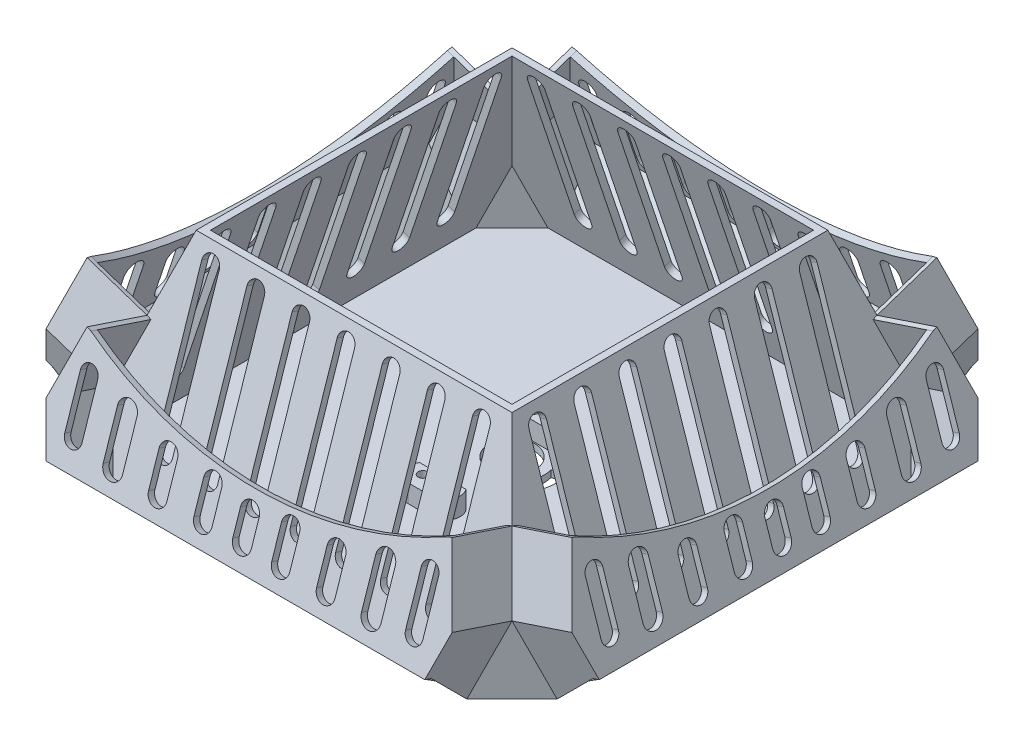
from build123d import *

# Parameters (mm, degrees)
CUT_EXTRUDE_1_DEPTH         = 128
SHELL_2_T                   = -3
EXTRUDE_1_DEPTH             = 25
EXTRUDE_2_DEPTH             = 25
EXTRUDE_3_DEPTH             = 25
EXTRUDE_4_DEPTH             = 25
CUT_EXTRUDE_2_DEPTH         = 130
CUT_EXTRUDE_3_DEPTH         = 130
CUT_EXTRUDE_4_DEPTH         = 130
SKETCH_14_R                 = 3.5
CUT_EXTRUDE_5_DEPTH         = 130
EXTRUDE_8_REACH             = 193.799
EXTRUDE_8_DIRECTION_2_REACH = 193.799
EXTRUDE_9_REACH             = 193.799
EXTRUDE_9_DIRECTION_2_REACH = 193.799
SKETCH_20_R                 = 10.1
CUT_EXTRUDE_6_DEPTH         = 26
CUT_EXTRUDE_7_DEPTH         = 10
PATTERN_CIRCULAR_2_COUNT    = 4
SKETCH_26_R                 = 2.1
CUT_EXTRUDE_10_DEPTH        = 10
SKETCH_37_R                 = 45
SKETCH_37_R_2               = 32.5
CUT_EXTRUDE_13_DEPTH        = 1
CUT_EXTRUDE_14_DEPTH        = 10
EXTRUDE_17_DEPTH            = 8
CUT_EXTRUDE_START           = -160
SKETCH_54_R                 = 2.1
SKETCH_54_R_2               = 10.1
CUT_EXTRUDE_15_DEPTH        = 160
CUT_EXTRUDE_16_DEPTH        = 160
PATTERN_CIRCULAR_3_COUNT    = 4
EXTRUDE_22_DEPTH            = 25
PATTERN_CIRCULAR_4_COUNT    = 4
EXTRUDE_24_DEPTH            = 3
PATTERN_CIRCULAR_5_COUNT    = 4
EXTRUDE_25_DEPTH            = 83.5
PATTERN_CIRCULAR_6_COUNT    = 4


with BuildPart() as part:
    # 草图2 → 放样1 section 0
    with BuildSketch(Plane(origin=(0, -90, 0), x_dir=(1, 0, 0), z_dir=(0, 1, 0))):
        with BuildLine():
            Line((-100, -100), (100, -100))
            Line((100, -100), (100, 100))
            Line((100, 100), (-100, 100))
            Line((-100, 100), (-100, -100))
        make_face()
    # 草图1 → 放样1 section 1
    with BuildSketch(Plane(origin=(0, 0, 0), x_dir=(1, 0, 0), z_dir=(0, 1, 0))):
        with BuildLine():
            Line((-70, 70), (70, 70))
            Line((70, 70), (70, -70))
            Line((70, -70), (-70, -70))
            Line((-70, -70), (-70, 70))
        make_face()
    loft()

    # 草图4 → 切除-拉伸1 (cut)
    with BuildSketch(Plane(origin=(0, 0, 0), x_dir=(1, 0, 0), z_dir=(0, 1, 0))):
        Polygon((-80, 100), (-100, 80), (-100, 100), align=None)
        Polygon((100, 80), (80, 100), (100, 100), align=None)
        Polygon((80, -100), (100, -80), (100, -100), align=None)
        Polygon((-100, -80), (-80, -100), (-100, -100), align=None)
    extrude(amount=-CUT_EXTRUDE_1_DEPTH, mode=Mode.SUBTRACT)

    # 抽壳2
    shell_2_openings = [part.faces().sort_by_distance(p)[0] for p in [
        (0, 0, 0),
    ]]
    offset(amount=SHELL_2_T, openings=shell_2_openings, kind=Kind.INTERSECTION)

    # 草图6 → 凸台-拉伸1 (add)
    with BuildSketch(Plane(origin=(0, 21, -63), x_dir=(-1, 0, 0), z_dir=(0, 0.3162277660168379, -0.9486832980505139))):
        Polygon((-90, -85.381496825), (-80, -117.004273426), (-76.853573455, -117.004273426), (-88.426786728, -80.406559639), align=None)
        Polygon((90, -85.381496825), (80, -117.004273426), (76.853573455, -117.004273426), (88.426786728, -80.406559639), align=None)
    extrude(amount=EXTRUDE_1_DEPTH)

    # 草图7 → 凸台-拉伸2 (add)
    with BuildSketch(Plane(origin=(-63, 21, 0), x_dir=(0, 0, 1), z_dir=(-0.9486832980505135, 0.31622776601683855, 0))):
        Polygon((-80, -117.004273426), (-90, -85.381496825), (-88.426786728, -80.406559639), (-76.853573455, -117.004273426), align=None)
        Polygon((80, -117.004273426), (90, -85.381496825), (88.426786728, -80.406559639), (76.853573455, -117.004273426), align=None)
    extrude(amount=EXTRUDE_2_DEPTH)

    # 草图8 → 凸台-拉伸3 (add)
    with BuildSketch(Plane(origin=(0, 21, 63), x_dir=(1, 0, 0), z_dir=(0, 0.3162277660168379, 0.9486832980505139))):
        Polygon((-90, -85.381496825), (-80, -117.004273426), (-76.853573455, -117.004273426), (-88.426786728, -80.406559639), align=None)
        Polygon((90, -85.381496825), (80, -117.004273426), (76.853573455, -117.004273426), (88.426786728, -80.406559639), align=None)
    extrude(amount=EXTRUDE_3_DEPTH)

    # 草图9 → 凸台-拉伸4 (add)
    with BuildSketch(Plane(origin=(63, 21, 0), x_dir=(0, 0, -1), z_dir=(0.9486832980505138, 0.316227766016838, 0))):
        Polygon((-90, -85.381496825), (-80, -117.004273426), (-76.853573455, -117.004273426), (-88.426786728, -80.406559639), align=None)
        Polygon((80, -117.004273426), (90, -85.381496825), (88.426786728, -80.406559639), (76.853573455, -117.004273426), align=None)
    extrude(amount=EXTRUDE_4_DEPTH)

    # 草图11 → 切除-拉伸2 (cut, symmetric)
    with BuildSketch(Plane.XY):
        Polygon((-100, -90), (-128.566874954, -61.433125046), (-128.566874954, -90), align=None)
    extrude(amount=CUT_EXTRUDE_2_DEPTH, both=True, mode=Mode.SUBTRACT)

    # 草图12 → 切除-拉伸3 (cut, symmetric)
    with BuildSketch(Plane(origin=(0, 0, 0), x_dir=(0, 0, -1), z_dir=(1, 0, 0))):
        Polygon((-100, -90), (-128.76067301, -61.23932699), (-128.76067301, -90), align=None)
        Polygon((128.76067301, -90), (100, -90), (128.76067301, -61.23932699), align=None)
    extrude(amount=CUT_EXTRUDE_3_DEPTH, both=True, mode=Mode.SUBTRACT)

    # 草图13 → 切除-拉伸4 (cut, symmetric)
    with BuildSketch(Plane.XY):
        Polygon((100, -90), (131.317962746, -58.682037254), (131.317962746, -90), align=None)
    extrude(amount=CUT_EXTRUDE_4_DEPTH, both=True, mode=Mode.SUBTRACT)

    # 草图14 → 切除-拉伸5 (cut, symmetric)
    with BuildSketch(Plane(origin=(0, -87, 0), x_dir=(1, 0, 0), z_dir=(0, 1, 0))):
        Circle(SKETCH_14_R)
    extrude(amount=CUT_EXTRUDE_5_DEPTH, both=True, mode=Mode.SUBTRACT)

    # 草图17 → 凸台-拉伸8 (add, up to next)
    with BuildSketch(Plane(origin=(0, 0, 0), x_dir=(0, 0, -1), z_dir=(1, 0, 0)), mode=Mode.PRIVATE) as extrude_8_sk1:
        Polygon((-119.764235376, -70.235764624), (-100, -90), (-98.939339828, -86.818019485), (-118.703575204, -67.053784109), align=None)
    extrude_8_tool1 = extrude(extrude_8_sk1.sketch, amount=EXTRUDE_8_REACH, mode=Mode.PRIVATE) - part.part
    # 草图17 → 凸台-拉伸8 (add, up to next)
    with BuildSketch(Plane(origin=(0, 0, 0), x_dir=(0, 0, -1), z_dir=(1, 0, 0)), mode=Mode.PRIVATE) as extrude_8_sk2:
        Polygon((118.703575204, -67.053784109), (119.764235376, -70.235764624), (100, -90), (98.939339828, -86.818019485), align=None)
    extrude_8_tool2 = extrude(extrude_8_sk2.sketch, amount=EXTRUDE_8_REACH, mode=Mode.PRIVATE) - part.part
    extrude_8_1 = extrude_8_tool1.solids().sort_by_distance((0, -78.526892, 109.351788))[0]
    add(extrude_8_1)
    extrude_8_2 = extrude_8_tool2.solids().sort_by_distance((0, -78.526892, -109.351788))[0]
    add(extrude_8_2)
    extrude_8 = extrude_8_1 + extrude_8_2  # 凸台-拉伸8 as one shape, for the pattern or mirror that repeats it

    # 草图17 → 凸台-拉伸8 direction 2 (add, up to next)
    with BuildSketch(Plane(origin=(0, 0, 0), x_dir=(0, 0, -1), z_dir=(1, 0, 0)), mode=Mode.PRIVATE) as extrude_8_direction_2_sk1:
        Polygon((-119.764235376, -70.235764624), (-100, -90), (-98.939339828, -86.818019485), (-118.703575204, -67.053784109), align=None)
    extrude_8_direction_2_tool1 = extrude(extrude_8_direction_2_sk1.sketch, amount=-EXTRUDE_8_DIRECTION_2_REACH, mode=Mode.PRIVATE) - part.part
    # 草图17 → 凸台-拉伸8 direction 2 (add, up to next)
    with BuildSketch(Plane(origin=(0, 0, 0), x_dir=(0, 0, -1), z_dir=(1, 0, 0)), mode=Mode.PRIVATE) as extrude_8_direction_2_sk2:
        Polygon((118.703575204, -67.053784109), (119.764235376, -70.235764624), (100, -90), (98.939339828, -86.818019485), align=None)
    extrude_8_direction_2_tool2 = extrude(extrude_8_direction_2_sk2.sketch, amount=-EXTRUDE_8_DIRECTION_2_REACH, mode=Mode.PRIVATE) - part.part
    extrude_8_direction_2_1 = extrude_8_direction_2_tool1.solids().sort_by_distance((0, -78.526892, 109.351788))[0]
    add(extrude_8_direction_2_1)
    extrude_8_direction_2_2 = extrude_8_direction_2_tool2.solids().sort_by_distance((0, -78.526892, -109.351788))[0]
    add(extrude_8_direction_2_2)
    extrude_8_direction_2 = extrude_8_direction_2_1 + extrude_8_direction_2_2  # 凸台-拉伸8 direction 2 as one shape, for the pattern or mirror that repeats it

    # 草图18 → 凸台-拉伸9 (add, up to next)
    with BuildSketch(Plane.XY, mode=Mode.PRIVATE) as extrude_9_sk1:
        Polygon((-119.764235376, -70.235764624), (-100, -90), (-98.939339828, -86.818019485), (-118.703575204, -67.053784109), align=None)
    extrude_9_tool1 = extrude(extrude_9_sk1.sketch, amount=EXTRUDE_9_REACH, mode=Mode.PRIVATE) - part.part
    # 草图18 → 凸台-拉伸9 (add, up to next)
    with BuildSketch(Plane.XY, mode=Mode.PRIVATE) as extrude_9_sk2:
        Polygon((118.703575204, -67.053784109), (119.764235376, -70.235764624), (100, -90), (98.939339828, -86.818019485), align=None)
    extrude_9_tool2 = extrude(extrude_9_sk2.sketch, amount=EXTRUDE_9_REACH, mode=Mode.PRIVATE) - part.part
    add(extrude_9_tool1.solids().sort_by_distance((-109.351788, -78.526892, 0))[0])
    add(extrude_9_tool2.solids().sort_by_distance((109.351788, -78.526892, 0))[0])

    # 草图18 → 凸台-拉伸9 direction 2 (add, up to next)
    with BuildSketch(Plane.XY, mode=Mode.PRIVATE) as extrude_9_direction_2_sk1:
        Polygon((-119.764235376, -70.235764624), (-100, -90), (-98.939339828, -86.818019485), (-118.703575204, -67.053784109), align=None)
    extrude_9_direction_2_tool1 = extrude(extrude_9_direction_2_sk1.sketch, amount=-EXTRUDE_9_DIRECTION_2_REACH, mode=Mode.PRIVATE) - part.part
    # 草图18 → 凸台-拉伸9 direction 2 (add, up to next)
    with BuildSketch(Plane.XY, mode=Mode.PRIVATE) as extrude_9_direction_2_sk2:
        Polygon((118.703575204, -67.053784109), (119.764235376, -70.235764624), (100, -90), (98.939339828, -86.818019485), align=None)
    extrude_9_direction_2_tool2 = extrude(extrude_9_direction_2_sk2.sketch, amount=-EXTRUDE_9_DIRECTION_2_REACH, mode=Mode.PRIVATE) - part.part
    add(extrude_9_direction_2_tool1.solids().sort_by_distance((-109.351788, -78.526892, 0))[0])
    add(extrude_9_direction_2_tool2.solids().sort_by_distance((109.351788, -78.526892, 0))[0])

    # 草图20 → 切除-拉伸6 (cut)
    with BuildSketch(Plane(origin=(0, -87, 0), x_dir=(1, 0, 0), z_dir=(0, 1, 0))):
        Circle(SKETCH_20_R)
    extrude(amount=-CUT_EXTRUDE_6_DEPTH, mode=Mode.SUBTRACT)

    # 草图22 → 切除-拉伸7 (cut)
    with BuildSketch(Plane(origin=(63, 21, 0), x_dir=(0, 0, -1), z_dir=(0.9486832980505138, 0.316227766016838, 0))):
        with BuildLine():
            Line((-57.244192957, -30.141167146), (-57.244192957, -95.509315719))
            ThreePointArc((-57.244192957, -95.509315719), (-61.105602577, -99.37072534), (-64.967012198, -95.509315719))
            Line((-64.967012198, -95.509315719), (-64.967012198, -30.141167146))
            ThreePointArc((-64.967012198, -30.141167146), (-61.105602577, -26.279757526), (-57.244192957, -30.141167146))
        make_face()
        with BuildLine():
            Line((-37.244192957, -30.141167146), (-37.244192957, -95.509315719))
            ThreePointArc((-37.244192957, -95.509315719), (-41.105602577, -99.37072534), (-44.967012198, -95.509315719))
            Line((-44.967012198, -95.509315719), (-44.967012198, -30.141167146))
            ThreePointArc((-44.967012198, -30.141167146), (-41.105602577, -26.279757526), (-37.244192957, -30.141167146))
        make_face()
        with BuildLine():
            Line((-17.244192957, -30.141167146), (-17.244192957, -95.509315719))
            ThreePointArc((-17.244192957, -95.509315719), (-21.105602577, -99.37072534), (-24.967012198, -95.509315719))
            Line((-24.967012198, -95.509315719), (-24.967012198, -30.141167146))
            ThreePointArc((-24.967012198, -30.141167146), (-21.105602577, -26.279757526), (-17.244192957, -30.141167146))
        make_face()
        with BuildLine():
            Line((2.755807043, -30.141167146), (2.755807043, -95.509315719))
            ThreePointArc((2.755807043, -95.509315719), (-1.105602577, -99.37072534), (-4.967012198, -95.509315719))
            Line((-4.967012198, -95.509315719), (-4.967012198, -30.141167146))
            ThreePointArc((-4.967012198, -30.141167146), (-1.105602577, -26.279757526), (2.755807043, -30.141167146))
        make_face()
        with BuildLine():
            Line((22.755807043, -30.141167146), (22.755807043, -95.509315719))
            ThreePointArc((22.755807043, -95.509315719), (18.894397423, -99.37072534), (15.032987802, -95.509315719))
            Line((15.032987802, -95.509315719), (15.032987802, -30.141167146))
            ThreePointArc((15.032987802, -30.141167146), (18.894397423, -26.279757526), (22.755807043, -30.141167146))
        make_face()
        with BuildLine():
            Line((42.755807043, -30.141167146), (42.755807043, -95.509315719))
            ThreePointArc((42.755807043, -95.509315719), (38.894397423, -99.37072534), (35.032987802, -95.509315719))
            Line((35.032987802, -95.509315719), (35.032987802, -30.141167146))
            ThreePointArc((35.032987802, -30.141167146), (38.894397423, -26.279757526), (42.755807043, -30.141167146))
        make_face()
        with BuildLine():
            Line((62.755807043, -30.141167146), (62.755807043, -95.509315719))
            ThreePointArc((62.755807043, -95.509315719), (58.894397423, -99.37072534), (55.032987802, -95.509315719))
            Line((55.032987802, -95.509315719), (55.032987802, -30.141167146))
            ThreePointArc((55.032987802, -30.141167146), (58.894397423, -26.279757526), (62.755807043, -30.141167146))
        make_face()
    cut_extrude_7 = extrude(amount=-CUT_EXTRUDE_7_DEPTH, mode=Mode.SUBTRACT)

    # 阵列(圆周)2: 切除-拉伸7 ×4 about axis
    pattern_circular_2_axis = Axis((0, -87, 0), (0, 1, 0))
    for i in range(1, PATTERN_CIRCULAR_2_COUNT):
        add(cut_extrude_7.rotate(pattern_circular_2_axis, i * 360 / PATTERN_CIRCULAR_2_COUNT), mode=Mode.SUBTRACT)

    # 草图26 → 切除-拉伸10 (cut)
    with BuildSketch(Plane(origin=(0, -87, 0), x_dir=(1, 0, 0), z_dir=(0, 1, 0))):
        with Locations((-5, 14.5)):
            Circle(SKETCH_26_R)
        with Locations((5, 14.5)):
            Circle(SKETCH_26_R)
        with Locations((-5, -34.5)):
            Circle(SKETCH_26_R)
        with Locations((5, -34.5)):
            Circle(SKETCH_26_R)
    extrude(amount=-CUT_EXTRUDE_10_DEPTH, mode=Mode.SUBTRACT)

    # 草图37 → 切除-拉伸13 (cut)
    with BuildSketch(Plane.XZ.offset(90)):
        Circle(SKETCH_37_R)
        Circle(SKETCH_37_R_2, mode=Mode.SUBTRACT)
    extrude(amount=-CUT_EXTRUDE_13_DEPTH, mode=Mode.SUBTRACT)

    # 草图51 → 切除-拉伸14 (cut)
    with BuildSketch(Plane.XZ.offset(90)):
        with BuildLine():
            Line((11.274243786, 8.482663674), (15.924356685, 11.981376716))
            ThreePointArc((15.924356685, 11.981376716), (19.56975543, 3.763402215), (19.23239617, -5.220484785))
            Line((19.23239617, -5.220484785), (13.616294039, -3.696037416))
            ThreePointArc((13.616294039, -3.696037416), (13.855140142, 2.664441326), (11.274243786, 8.482663674))
        make_face()
    extrude(amount=-CUT_EXTRUDE_14_DEPTH, mode=Mode.SUBTRACT)

    # 草图53 → 凸台-拉伸17 (add)
    with BuildSketch(Plane(origin=(0, -87, 0), x_dir=(1, 0, 0), z_dir=(0, 1, 0))):
        with BuildLine():
            Line((-5, 21), (5, 21))
            ThreePointArc((5, 21), (11.5, 14.5), (5, 8))
            Line((5, 8), (-5, 8))
            ThreePointArc((-5, 8), (-11.5, 14.5), (-5, 21))
        make_face()
        with BuildLine():
            Line((-5, -28), (5, -28))
            ThreePointArc((5, -28), (11.5, -34.5), (5, -41))
            Line((5, -41), (-5, -41))
            ThreePointArc((-5, -41), (-11.5, -34.5), (-5, -28))
        make_face()
    extrude(amount=EXTRUDE_17_DEPTH)

    # 草图54 → 切除-拉伸15 (cut)
    with BuildSketch(Plane.XZ.offset(90).offset(CUT_EXTRUDE_START)):
        with Locations((-5, -14.5)):
            Circle(SKETCH_54_R)
        with Locations((5, -14.5)):
            Circle(SKETCH_54_R)
        Circle(SKETCH_54_R_2)
        with Locations((-5, 34.5)):
            Circle(SKETCH_54_R)
        with Locations((5, 34.5)):
            Circle(SKETCH_54_R)
    extrude(amount=CUT_EXTRUDE_15_DEPTH, mode=Mode.SUBTRACT)

    # 草图55 → 切除-拉伸16 (cut)
    with BuildSketch(Plane(origin=(0, -87, 0), x_dir=(1, 0, 0), z_dir=(0, 1, 0))):
        Polygon((-18.918480448, 0), (-18.918480448, 10.592417019), (17.554249374, 10.592417019), (17.554249374, 0), (17.554249374, -30.679771727), (-18.918480448, -30.679771727), align=None)
    extrude(amount=CUT_EXTRUDE_16_DEPTH, mode=Mode.SUBTRACT)

    # 阵列(圆周)3: 凸台-拉伸8, 凸台-拉伸8 direction 2 ×4 about axis
    pattern_circular_3_axis = Axis((0, -113, 0), (0, 1, 0))
    add([extrude_8.rotate(pattern_circular_3_axis, i * 360 / PATTERN_CIRCULAR_3_COUNT) for i in range(1, PATTERN_CIRCULAR_3_COUNT)])
    add([extrude_8_direction_2.rotate(pattern_circular_3_axis, i * 360 / PATTERN_CIRCULAR_3_COUNT) for i in range(1, PATTERN_CIRCULAR_3_COUNT)])

    # 草图57 → 凸台-拉伸22 (add)
    with BuildSketch(Plane(origin=(-63, 21, 0), x_dir=(0, 0, 1), z_dir=(-0.9486832980505137, 0.3162277660168387, 0))):
        Polygon((-88.426786728, -80.406559639), (-80.889003113, -56.569994908), (-78.982077935, -57.173017597), (-87.37797788, -83.723184429), align=None)
        Polygon((88.426786728, -80.406559639), (87.37797788, -83.723184429), (78.982077935, -57.173017597), (80.889003113, -56.569994908), align=None)
    extrude_22 = extrude(amount=EXTRUDE_22_DEPTH)

    # 阵列(圆周)4: 凸台-拉伸22 ×4 about axis
    pattern_circular_4_axis = Axis((0, -113, 0), (0, 1, 0))
    for i in range(1, PATTERN_CIRCULAR_4_COUNT):
        add(extrude_22.rotate(pattern_circular_4_axis, i * 360 / PATTERN_CIRCULAR_4_COUNT))

    # 草图58 → 凸台-拉伸24 (add)
    with BuildSketch(Plane(origin=(0, 28.90569415, 86.717082451), x_dir=(1, 0, 0), z_dir=(0, 0.3162277660168397, 0.9486832980505133))):
        with BuildLine():
            Line((-80.889003113, -56.569994908), (-90, -85.381496825))
            Line((-90, -85.381496825), (-83.952847075, -104.504273426))
            Line((-83.952847075, -104.504273426), (83.952847075, -104.504273426))
            Line((83.952847075, -104.504273426), (90, -85.381496825))
            Line((90, -85.381496825), (80.889003113, -56.569994908))
            Line((80.889003113, -56.569994908), (78.982077935, -57.173017597))
            ThreePointArc((78.982077935, -57.173017597), (0, -76.192185229), (-78.982077935, -57.173017597))
            Line((-78.982077935, -57.173017597), (-80.889003113, -56.569994908))
        make_face()
        with BuildLine():
            Line((4.128077725, -84.293589392), (4.128077725, -95.129848699))
            ThreePointArc((4.128077725, -95.129848699), (0, -99.257926424), (-4.128077725, -95.129848699))
            Line((-4.128077725, -95.129848699), (-4.128077725, -84.293589392))
            ThreePointArc((-4.128077725, -84.293589392), (0, -80.165511668), (4.128077725, -84.293589392))
        make_face(mode=Mode.SUBTRACT)
        with BuildLine():
            Line((-13.241808518, -81.74388132), (-13.241808518, -95.509315719))
            ThreePointArc((-13.241808518, -95.509315719), (-17.244192957, -99.511700159), (-21.246577396, -95.509315719))
            Line((-21.246577396, -95.509315719), (-21.246577396, -81.74388132))
            ThreePointArc((-21.246577396, -81.74388132), (-17.244192957, -77.741496881), (-13.241808518, -81.74388132))
        make_face(mode=Mode.SUBTRACT)
        with BuildLine():
            Line((-33.161402832, -80.787740793), (-33.161402832, -95.509315719))
            ThreePointArc((-33.161402832, -95.509315719), (-37.244192957, -99.592105844), (-41.326983082, -95.509315719))
            Line((-41.326983082, -95.509315719), (-41.326983082, -80.787740793))
            ThreePointArc((-41.326983082, -80.787740793), (-37.244192957, -76.704950668), (-33.161402832, -80.787740793))
        make_face(mode=Mode.SUBTRACT)
        with BuildLine():
            Line((-52.921640392, -75.05089763), (-52.921640392, -95.129848699))
            ThreePointArc((-52.921640392, -95.129848699), (-57.244192957, -99.452401264), (-61.566745522, -95.129848699))
            Line((-61.566745522, -95.129848699), (-61.566745522, -75.05089763))
            ThreePointArc((-61.566745522, -75.05089763), (-57.244192957, -70.728345066), (-52.921640392, -75.05089763))
        make_face(mode=Mode.SUBTRACT)
        with BuildLine():
            Line((-71.725737425, -70.728345066), (-71.725737425, -92.739497382))
            ThreePointArc((-71.725737425, -92.739497382), (-75.550299534, -96.56405949), (-79.374861642, -92.739497382))
            Line((-79.374861642, -92.739497382), (-79.374861642, -70.728345066))
            ThreePointArc((-79.374861642, -70.728345066), (-75.550299534, -66.903782957), (-71.725737425, -70.728345066))
        make_face(mode=Mode.SUBTRACT)
        with BuildLine():
            Line((71.725737425, -70.728345066), (71.725737425, -92.739497382))
            ThreePointArc((71.725737425, -92.739497382), (75.550299534, -96.56405949), (79.374861642, -92.739497382))
            Line((79.374861642, -92.739497382), (79.374861642, -70.728345066))
            ThreePointArc((79.374861642, -70.728345066), (75.550299534, -66.903782957), (71.725737425, -70.728345066))
        make_face(mode=Mode.SUBTRACT)
        with BuildLine():
            Line((52.921640392, -75.05089763), (52.921640392, -95.129848699))
            ThreePointArc((52.921640392, -95.129848699), (57.244192957, -99.452401264), (61.566745522, -95.129848699))
            Line((61.566745522, -95.129848699), (61.566745522, -75.05089763))
            ThreePointArc((61.566745522, -75.05089763), (57.244192957, -70.728345066), (52.921640392, -75.05089763))
        make_face(mode=Mode.SUBTRACT)
        with BuildLine():
            Line((33.161402832, -80.787740793), (33.161402832, -95.509315719))
            ThreePointArc((33.161402832, -95.509315719), (37.244192957, -99.592105844), (41.326983082, -95.509315719))
            Line((41.326983082, -95.509315719), (41.326983082, -80.787740793))
            ThreePointArc((41.326983082, -80.787740793), (37.244192957, -76.704950668), (33.161402832, -80.787740793))
        make_face(mode=Mode.SUBTRACT)
        with BuildLine():
            Line((13.241808518, -81.74388132), (13.241808518, -95.509315719))
            ThreePointArc((13.241808518, -95.509315719), (17.244192957, -99.511700159), (21.246577396, -95.509315719))
            Line((21.246577396, -95.509315719), (21.246577396, -81.74388132))
            ThreePointArc((21.246577396, -81.74388132), (17.244192957, -77.741496881), (13.241808518, -81.74388132))
        make_face(mode=Mode.SUBTRACT)
    extrude_24 = extrude(amount=EXTRUDE_24_DEPTH)

    # 阵列(圆周)5: 凸台-拉伸24 ×4 about axis
    pattern_circular_5_axis = Axis((0, -113, 0), (0, 1, 0))
    for i in range(1, PATTERN_CIRCULAR_5_COUNT):
        add(extrude_24.rotate(pattern_circular_5_axis, i * 360 / PATTERN_CIRCULAR_5_COUNT))

    # 草图60 → 凸台-拉伸25 (add, symmetric)
    with BuildSketch(Plane(origin=(0, 0, 0), x_dir=(0, 0, -1), z_dir=(1, 0, 0))):
        Polygon((122.61028527, -69.287081326), (117.406751223, -72.593248777), (119.764235376, -70.235764624), align=None)
    extrude_25 = extrude(amount=EXTRUDE_25_DEPTH, both=True)

    # 阵列(圆周)6: 凸台-拉伸25 ×4 about axis
    pattern_circular_6_axis = Axis((0, -113, 0), (0, 1, 0))
    for i in range(1, PATTERN_CIRCULAR_6_COUNT):
        add(extrude_25.rotate(pattern_circular_6_axis, i * 360 / PATTERN_CIRCULAR_6_COUNT))


solid = part.part
